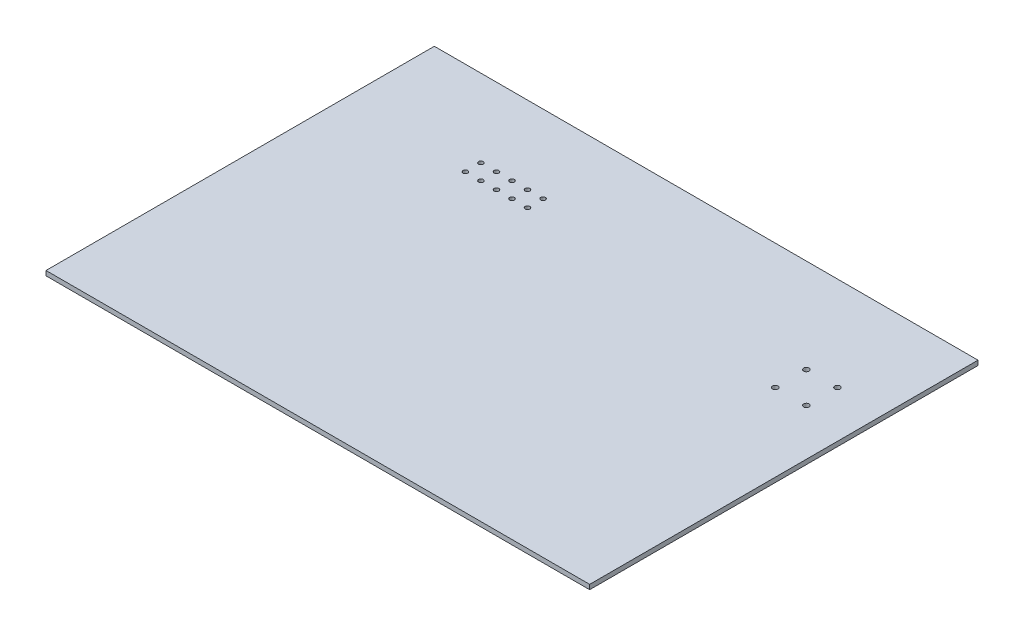
from build123d import *

# Parameters (mm, degrees)
SKETCH1_W           = 350
SKETCH1_H           = 250
BOSS_EXTRUDE1_DEPTH = 3
SKETCH2_R           = 1.75
CUT_EXTRUDE1_DEPTH  = 10
SKETCH4_R           = 1.5
CUT_EXTRUDE3_DEPTH  = 20


with BuildPart() as part:
    # Sketch1 → Boss-Extrude1 (new body)
    with BuildSketch(Plane(origin=(0, 0, 0), x_dir=(1, 0, 0), z_dir=(0, 1, 0))):
        Rectangle(SKETCH1_W, SKETCH1_H)
    extrude(amount=BOSS_EXTRUDE1_DEPTH)

    # Sketch2 → Cut-Extrude1 (cut)
    with BuildSketch(Plane(origin=(0, 3, 0), x_dir=(1, 0, 0), z_dir=(0, 1, 0))):
        with Locations((125, 64.5)):
            Circle(SKETCH2_R)
        with Locations((145, 64.5)):
            Circle(SKETCH2_R)
        with Locations((125, 44.5)):
            Circle(SKETCH2_R)
        with Locations((145, 44.5)):
            Circle(SKETCH2_R)
    extrude(amount=-CUT_EXTRUDE1_DEPTH, mode=Mode.SUBTRACT)

    # Sketch4 → Cut-Extrude3 (cut)
    with BuildSketch(Plane(origin=(0, 3, 0), x_dir=(1, 0, 0), z_dir=(0, 1, 0))):
        with Locations((-95, 65)):
            Circle(SKETCH4_R)
        with Locations((-85, 65)):
            Circle(SKETCH4_R)
        with Locations((-75, 65)):
            Circle(SKETCH4_R)
        with Locations((-65, 65)):
            Circle(SKETCH4_R)
        with Locations((-55, 65)):
            Circle(SKETCH4_R)
        with Locations((-85, 75)):
            Circle(SKETCH4_R)
        with Locations((-75, 75)):
            Circle(SKETCH4_R)
        with Locations((-65, 75)):
            Circle(SKETCH4_R)
        with Locations((-55, 75)):
            Circle(SKETCH4_R)
        with Locations((-95, 75)):
            Circle(SKETCH4_R)
    extrude(amount=-CUT_EXTRUDE3_DEPTH, mode=Mode.SUBTRACT)


solid = part.part
